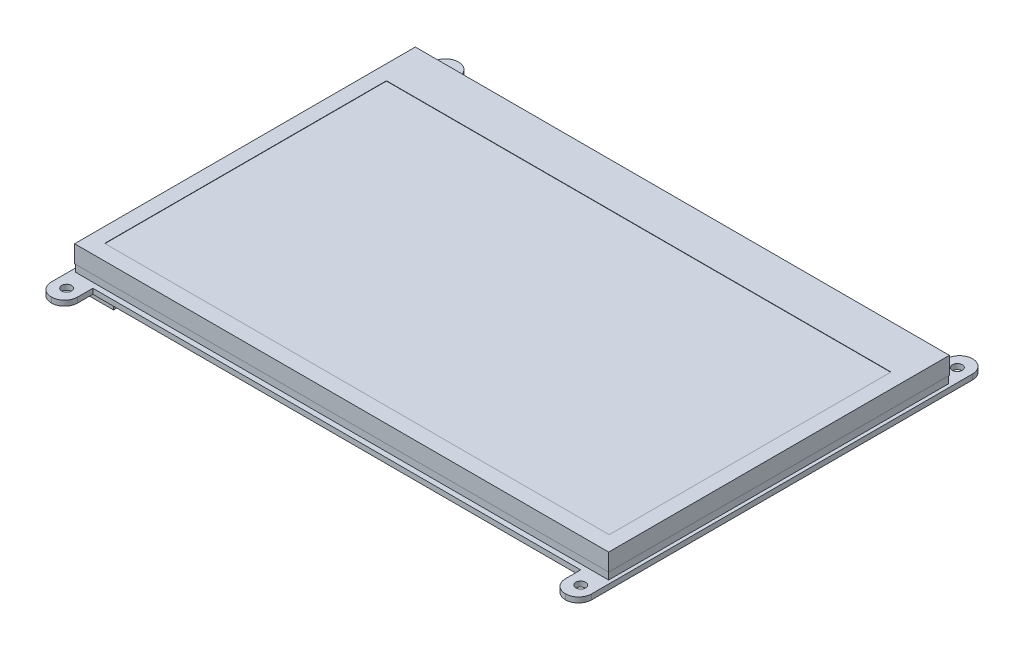
from build123d import *

# Parameters (mm, degrees)
SKETCH_1_W          = 164.9
SKETCH_1_H          = 124.27
EXTRUDE_2_DEPTH     = 1.6
SKETCH_2_W          = 148.9
SKETCH_2_H          = 8.655
CUT_EXTRUDE_1_DEPTH = 104.253671726
SKETCH_3_W          = 163
SKETCH_3_H          = 104
EXTRUDE_4_DEPTH     = 7.5
SKETCH_4_W          = 11.3
SKETCH_4_H          = 15.3
EXTRUDE_5_DEPTH     = 5
SKETCH_6_W          = 3.5
SKETCH_6_H          = 9.85
EXTRUDE_6_DEPTH     = 4.5
FILLET_1_R          = 1
FILLET_2_R          = 1
SKETCH_7_R          = 1.5
CUT_EXTRUDE_3_DEPTH = 105.438837245
FILLET_3_R          = 4
SKETCH_9_W          = 154
SKETCH_9_H          = 86
CUT_EXTRUDE_5_DEPTH = 0.1
CUT_EXTRUDE_6_DEPTH = 5
SKETCH_11_W         = 5.8
SKETCH_11_H         = 7.8
EXTRUDE_7_DEPTH     = 2.6
SKETCH_12_W         = 3.6
SKETCH_12_H         = 9
EXTRUDE_8_DEPTH     = 3.5
SKETCH_13_W         = 1.5
SKETCH_13_H         = 4
CUT_EXTRUDE_7_DEPTH = 0.1
SKETCH_14_W         = 1.5
SKETCH_14_H         = 2
EXTRUDE_9_DEPTH     = 2
SKETCH_15_W         = 19.8
SKETCH_15_H         = 13.8
EXTRUDE_10_DEPTH    = 2
SKETCH_16_W         = 163
SKETCH_16_H         = 104
SKETCH_16_W_2       = 162.8
SKETCH_16_H_2       = 103.8
CUT_EXTRUDE_9_DEPTH = 2.2


# Some blends are built 0.0001 mm under size
with BuildPart() as part:
    # 草图1 → 凸台-拉伸2 (new body)
    with BuildSketch(Plane(origin=(0, 0, 0), x_dir=(1, 0, 0), z_dir=(0, 1, 0))):
        Rectangle(SKETCH_1_W, SKETCH_1_H)
    extrude(amount=EXTRUDE_2_DEPTH)

    # 草图2 → 切除-拉伸1 (cut, through all)
    with BuildSketch(Plane(origin=(0, 1.6, 0), x_dir=(1, 0, 0), z_dir=(0, 1, 0))):
        with Locations((0, 57.8075)):
            Rectangle(SKETCH_2_W, SKETCH_2_H)
        with Locations((0, -57.8075)):
            Rectangle(SKETCH_2_W, SKETCH_2_H)
    extrude(amount=-CUT_EXTRUDE_1_DEPTH, mode=Mode.SUBTRACT)

    # 草图3 → 凸台-拉伸4 (add)
    with BuildSketch(Plane(origin=(0, 1.6, 0), x_dir=(1, 0, 0), z_dir=(0, 1, 0))):
        Rectangle(SKETCH_3_W, SKETCH_3_H)
    extrude(amount=EXTRUDE_4_DEPTH)

    # 草图4 → 凸台-拉伸5 (add)
    with BuildSketch(Plane.XZ):
        with Locations((-77.8, 41.83)):
            Rectangle(SKETCH_4_W, SKETCH_4_H)
    extrude(amount=EXTRUDE_5_DEPTH)

    # 草图6 → 凸台-拉伸6 (add)
    with BuildSketch(Plane(origin=(0, 0, 0), x_dir=(-1, 0, 0), z_dir=(0, -1, 0))):
        with Locations((46.2, 26.555)):
            Rectangle(SKETCH_6_W, SKETCH_6_H)
    extrude(amount=EXTRUDE_6_DEPTH)

    # 圆角1
    fillet_1_edges = [part.edges().sort_by_distance(p)[0] for p in [
        (-44.45, -4.5, -26.555),
        (-46.2, -4.5, -21.63),
        (-47.95, -4.5, -26.555),
        (-46.2, -4.5, -31.48),
    ]]
    fillet(fillet_1_edges, radius=FILLET_1_R)

    # 圆角2
    # the kernel refuses this fillet: 1 mm, written as the material it takes off along each edge
    with BuildSketch(Plane(origin=(-46.95, -3.5, -22.63), x_dir=(0, 0, 1), z_dir=(-1, 0, 0))) as fillet_2_piece_1_section:
        Polygon((0, 0), (FILLET_2_R, 0), (FILLET_2_R, -FILLET_2_R), (0, -FILLET_2_R), align=None)
    fillet_2_piece_1 = extrude(amount=FILLET_2_R, mode=Mode.PRIVATE)
    fillet_2_piece_1 = fillet_2_piece_1 - Plane(origin=(-46.95, -3.5, -22.63), x_dir=(0, 0.7071067811865475, -0.7071067811865475), z_dir=(-1, 0, 0)) * Sphere(FILLET_2_R, mode=Mode.PRIVATE)
    add(fillet_2_piece_1, mode=Mode.SUBTRACT)
    with BuildSketch(Plane(origin=(-45.45, -3.5, -22.63), x_dir=(1, 0, 0), z_dir=(0, 0, 1))) as fillet_2_piece_2_section:
        Polygon((0, 0), (FILLET_2_R, 0), (FILLET_2_R, -FILLET_2_R), (0, -FILLET_2_R), align=None)
    fillet_2_piece_2 = extrude(amount=FILLET_2_R, mode=Mode.PRIVATE)
    fillet_2_piece_2 = fillet_2_piece_2 - Plane(origin=(-45.45, -3.5, -22.63), x_dir=(-0.7071067811865475, 0.7071067811865475, 0), z_dir=(0, 0, 1)) * Sphere(FILLET_2_R, mode=Mode.PRIVATE)
    add(fillet_2_piece_2, mode=Mode.SUBTRACT)
    with BuildSketch(Plane(origin=(-46.95, -3.5, -30.48), x_dir=(0, 0, -1), z_dir=(-1, 0, 0))) as fillet_2_piece_3_section:
        Polygon((0, 0), (FILLET_2_R, 0), (FILLET_2_R, FILLET_2_R), (0, FILLET_2_R), align=None)
    fillet_2_piece_3 = extrude(amount=FILLET_2_R, mode=Mode.PRIVATE)
    fillet_2_piece_3 = fillet_2_piece_3 - Plane(origin=(-46.95, -3.5, -30.48), x_dir=(0, 0.7071067811865475, 0.7071067811865475), z_dir=(-1, 0, 0)) * Sphere(FILLET_2_R, mode=Mode.PRIVATE)
    add(fillet_2_piece_3, mode=Mode.SUBTRACT)
    with BuildSketch(Plane(origin=(-45.45, -3.5, -30.48), x_dir=(1, 0, 0), z_dir=(0, 0, -1))) as fillet_2_piece_4_section:
        Polygon((0, 0), (FILLET_2_R, 0), (FILLET_2_R, FILLET_2_R), (0, FILLET_2_R), align=None)
    fillet_2_piece_4 = extrude(amount=FILLET_2_R, mode=Mode.PRIVATE)
    fillet_2_piece_4 = fillet_2_piece_4 - Plane(origin=(-45.45, -3.5, -30.48), x_dir=(-0.7071067811865475, 0.7071067811865475, 0), z_dir=(0, 0, -1)) * Sphere(FILLET_2_R, mode=Mode.PRIVATE)
    add(fillet_2_piece_4, mode=Mode.SUBTRACT)
    with BuildSketch(Plane(origin=(-44.45, 0, -31.48), x_dir=(-1, 0, 0), z_dir=(0, -1, 0)), Plane(origin=(-47.95, 0, -31.48), x_dir=(0, 0, 1), z_dir=(0, -1, 0))) as fillet_2_piece_5:
        with BuildLine():
            CenterArc((FILLET_2_R, -FILLET_2_R), FILLET_2_R, 90, 90)
            Line((0, -FILLET_2_R), (0, 0))
            Line((0, 0), (FILLET_2_R, 0))
        make_face()
    extrude(amount=3.5, mode=Mode.SUBTRACT)
    with BuildSketch(Plane(origin=(-47.95, 0, -21.63), x_dir=(0, 0, -1), z_dir=(0, -1, 0)), Plane(origin=(-44.45, 0, -21.63), x_dir=(-1, 0, 0), z_dir=(0, -1, 0))) as fillet_2_piece_6:
        with BuildLine():
            CenterArc((FILLET_2_R, FILLET_2_R), FILLET_2_R, 180, 90)
            Line((0, FILLET_2_R), (0, 0))
            Line((0, 0), (FILLET_2_R, 0))
        make_face()
    extrude(amount=3.5, mode=Mode.SUBTRACT)

    # 草图7 → 切除-拉伸3 (cut, through all)
    with BuildSketch(Plane.XZ):
        with Locations(Location((-78.45, 57.48, 0), (0, 0, 270))):
            Circle(SKETCH_7_R)
        with Locations(Location((78.45, 57.48, 0), (0, 0, 90))):
            Circle(SKETCH_7_R)
        with Locations(Location((78.45, -57.48, 0), (0, 0, 270))):
            Circle(SKETCH_7_R)
        with Locations(Location((-78.45, -57.48, 0), (0, 0, 90))):
            Circle(SKETCH_7_R)
    extrude(amount=-CUT_EXTRUDE_3_DEPTH, mode=Mode.SUBTRACT)

    # 圆角3
    fillet_3_edges = [part.edges().sort_by_distance(p)[0] for p in [
        (-74.45, 0.8, -62.135),
        (-82.45, 0.8, -62.135),
        (82.45, 0.8, -62.135),
        (74.45, 0.8, -62.135),
        (74.45, 0.8, 62.135),
        (82.45, 0.8, 62.135),
        (-74.45, 0.8, 62.135),
        (-82.45, 0.8, 62.135),
    ]]
    fillet(fillet_3_edges, radius=FILLET_3_R - 0.0001)  # a hair under: the kernel refuses the full size

    # 草图9 → 切除-拉伸5 (cut)
    with BuildSketch(Plane(origin=(0, 9.1, 0), x_dir=(1, 0, 0), z_dir=(0, 1, 0))):
        with Locations((0, -4.32)):
            Rectangle(SKETCH_9_W, SKETCH_9_H)
    extrude(amount=-CUT_EXTRUDE_5_DEPTH, mode=Mode.SUBTRACT)

    # 草图10 → 切除-拉伸6 (cut)
    with BuildSketch(Plane.ZY.offset(83.45)):
        Polygon((49.48, -2.5), (46.98, 0), (49.48, 0), align=None)
        Polygon((34.18, 0), (34.18, -2.5), (36.68, 0), align=None)
    extrude(amount=-CUT_EXTRUDE_6_DEPTH, mode=Mode.SUBTRACT)

    # 草图11 → 凸台-拉伸7 (add)
    with BuildSketch(Plane.XZ):
        with Locations((-79.65, 23.78)):
            Rectangle(SKETCH_11_W, SKETCH_11_H)
        with Locations((-79.65, 10.28)):
            Rectangle(SKETCH_11_W, SKETCH_11_H)
    extrude(amount=EXTRUDE_7_DEPTH)

    # 草图12 → 凸台-拉伸8 (add)
    with BuildSketch(Plane.XZ):
        with Locations((-76.65, -0.97)):
            Rectangle(SKETCH_12_W, SKETCH_12_H)
    extrude(amount=EXTRUDE_8_DEPTH)

    # 草图13 → 切除-拉伸7 (cut)
    with BuildSketch(Plane.XZ.offset(3.5)):
        with Locations((-76.65, -0.97)):
            Rectangle(SKETCH_13_W, SKETCH_13_H)
    extrude(amount=-CUT_EXTRUDE_7_DEPTH, mode=Mode.SUBTRACT)

    # 草图14 → 凸台-拉伸9 (add)
    with BuildSketch(Plane.XZ.offset(3.4)):
        with Locations((-76.65, 0.03)):
            Rectangle(SKETCH_14_W, SKETCH_14_H)
    extrude(amount=EXTRUDE_9_DEPTH)

    # 草图15 → 凸台-拉伸10 (add)
    with BuildSketch(Plane.XZ):
        with Locations((-11.55, 20.58)):
            Rectangle(SKETCH_15_W, SKETCH_15_H)
    extrude(amount=EXTRUDE_10_DEPTH)

    # 草图16 → 切除-拉伸9 (cut)
    with BuildSketch(Plane(origin=(0, 1.6, 0), x_dir=(1, 0, 0), z_dir=(0, 1, 0))):
        Rectangle(SKETCH_16_W, SKETCH_16_H)
        Rectangle(SKETCH_16_W_2, SKETCH_16_H_2, mode=Mode.SUBTRACT)
    extrude(amount=CUT_EXTRUDE_9_DEPTH, mode=Mode.SUBTRACT)


solid = part.part
